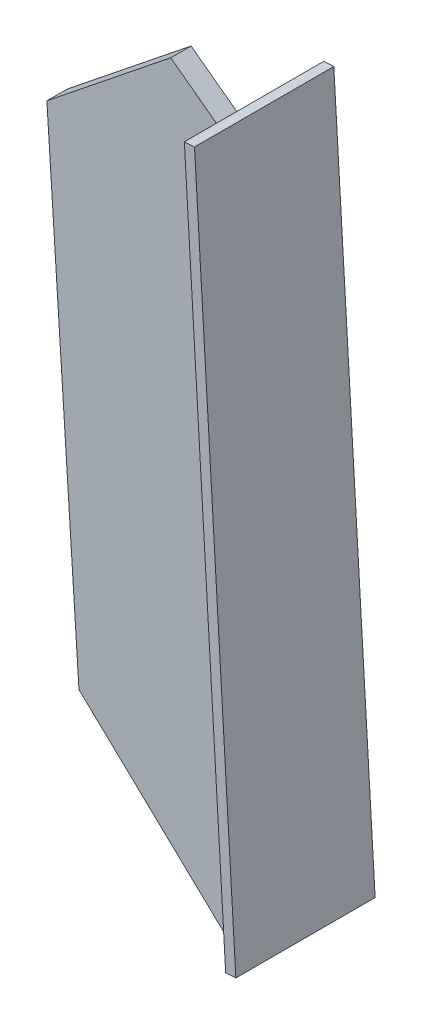
from build123d import *

# Parameters (mm, degrees)
EXTRUDE_1_DEPTH     = 1.2
CUT_EXTRUDE_START   = -1.2
CUT_EXTRUDE_1_DEPTH = 1.2
SKETCH_3_R          = 0.6
EXTRUDE_2_DEPTH     = 0.3
SKETCH_4_W          = 8.210741719
SKETCH_4_H          = 41.276753536
EXTRUDE_3_DEPTH     = 0.6


# Read off the part's stored shape, not the designer's step: Вырез-Вытянуть-Тонкостенный1
with BuildPart() as part:
    # Эскиз1 → Бобышка-Вытянуть1 (new body)
    with BuildSketch(Plane.XY):
        with BuildLine():
            Line((5.249737614, 19.025640721), (0.409977198, 22.613738961))
            Line((0.409977198, 22.613738961), (-7.294059401, 16.443030035))
            Line((-7.294059401, 16.443030035), (-5.378470688, -13.036872049))
            Line((-5.378470688, -13.036872049), (4.707402929, -22.613738961))
            Line((4.707402929, -22.613738961), (4.977734505, -22.318831787))
            add(Edge.make_bspline(
                [(4.977734505, -22.318831787), (5.380257217, -21.730973812), (6.179089351, -20.564331963), (6.904763741, -18.546948907), (7.294059401, -16.401738794), (7.239811, -14.930944587), (7.212045754, -14.178167322)],
                knots=[0, 0, 0, 0, 0.246766883, 0.489724704, 0.738832503, 1, 1, 1, 1], degree=3))
            Line((7.212045754, -14.178167322), (5.249737614, 19.025640721))
        make_face()
    extrude(amount=EXTRUDE_1_DEPTH)

    # Вырез-Вытянуть-Тонкостенный1 outline → Вырез-Вытянуть-Тонкостенный1 (cut)
    with BuildSketch(Plane.XY.offset(1.2).offset(CUT_EXTRUDE_START)):
        with BuildLine():
            Line((4.707402929, -22.613738961), (4.977734505, -22.318831787))
            add(Edge.make_bspline(
                [(4.977734505, -22.318831787), (5.380257217, -21.730973812), (6.179089351, -20.564331963), (6.904763741, -18.546948907), (7.294059401, -16.401738794), (7.239811, -14.930944587), (7.212045754, -14.178167322)],
                knots=[0, 0, 0, 0, 0.246766883, 0.489724704, 0.738832503, 1, 1, 1, 1], degree=3))
            Line((7.212045754, -14.178167322), (5.249737614, 19.025640721))
            Line((5.249737614, 19.025640721), (0.409977198, 22.613738961))
            Line((0.409977198, 22.613738961), (-7.294059401, 16.443030035))
            Line((-7.294059401, 16.443030035), (-5.378470688, -13.036872049))
            Line((-5.378470688, -13.036872049), (4.707402929, -22.613738961))
        make_face()
        with BuildLine():
            add(Edge.make_bspline(
                [(4.683954221, -22.039877798), (5.077205265, -21.465418253), (5.469505076, -20.890370995), (6.092414375, -19.640377114), (6.316902906, -18.988458608), (6.575666444, -17.98832874), (6.648049215, -17.650841196), (6.760734776, -16.966359137), (6.800621162, -16.619708847), (6.864229804, -15.582878491), (6.838032295, -14.890102205), (6.812480945, -14.197340575)],
                knots=[0, 0, 0, 0, 0.25, 0.25, 0.5, 0.5, 0.625, 0.625, 0.75, 0.75, 1, 1, 1, 1], degree=3))
            Line((4.683954221, -22.039877798), (-4.989468001, -12.854646977))
            Line((-4.989468001, -12.854646977), (-6.881392269, 16.261071759))
            Line((-6.881392269, 16.261071759), (0.419413416, 22.108804468))
            Line((0.419413416, 22.108804468), (4.861454817, 18.815566877))
            Line((4.861454817, 18.815566877), (6.812480945, -14.197340575))
        make_face(mode=Mode.SUBTRACT)
    extrude(amount=CUT_EXTRUDE_1_DEPTH, mode=Mode.SUBTRACT)

    # Эскиз3 → Бобышка-Вытянуть2 (add)
    with BuildSketch(Plane(origin=(5.952643232, 0.351794597, 0), x_dir=(0, 0, -1), z_dir=(0.9982582219819068, 0.05899595109430813, 0))):
        with Locations(Location((-0.6, 17.895988185, 0), (0, 0, 90))):
            Circle(SKETCH_3_R)
        with Locations((-0.6, 9.935988185)):
            Circle(SKETCH_3_R)
        with Locations((-0.6, 1.975988185)):
            Circle(SKETCH_3_R)
        with Locations((-0.6, -5.984011815)):
            Circle(SKETCH_3_R)
        with Locations((-0.6, -13.944011815)):
            Circle(SKETCH_3_R)
    extrude(amount=EXTRUDE_2_DEPTH)

    # Эскиз4 → Бобышка-Вытянуть3 (add)
    with BuildSketch(Plane(origin=(6.252120699, 0.369493382, 0), x_dir=(0, 0, -1), z_dir=(0.9982582219819068, 0.05899595109430812, 0))):
        with Locations((-0.847450423, 1.003287523)):
            Rectangle(SKETCH_4_W, SKETCH_4_H)
    extrude(amount=EXTRUDE_3_DEPTH)


solid = part.part
